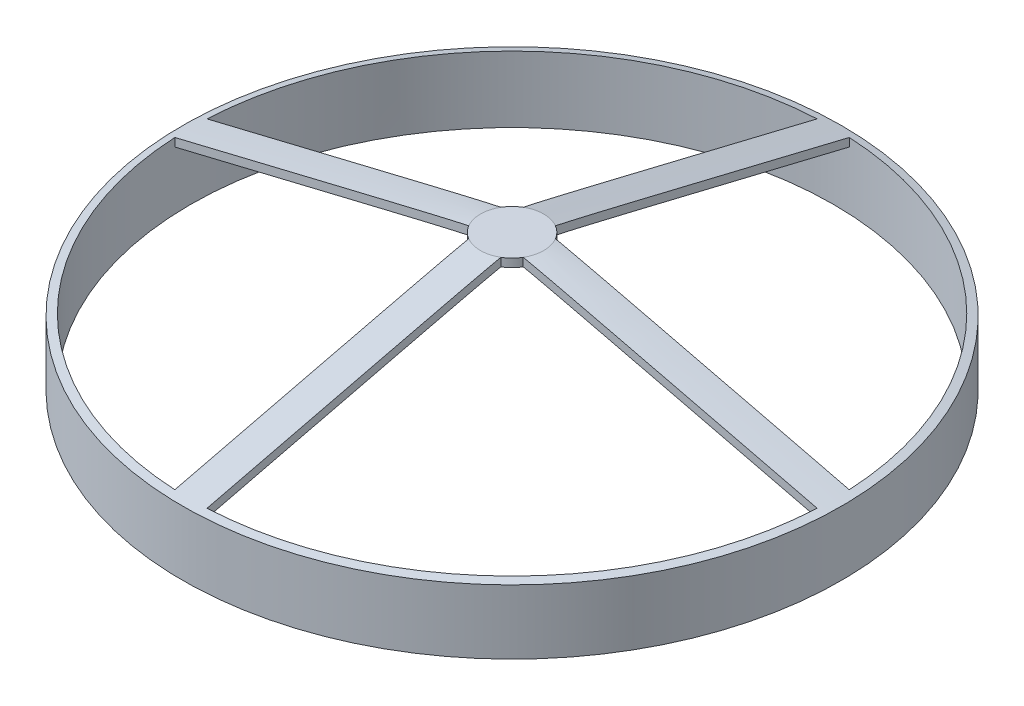
from build123d import *
from build123d.topology import SkipClean

# Parameters (mm, degrees)
SHELL1_T           = -3.175
CUT_EXTRUDE1_DEPTH = 192.844629518


with BuildPart() as part:
    # Sketch1 → Revolve1 (revolve)
    with BuildSketch(Plane.XY):
        Polygon((0, 0), (0, 53.975), (12.5, 53.975), (130.175, 25.4), (130.175, 0), align=None)
    revolve(axis=Axis((0, 0, 0), (0, 1, 0)))

    # Shell1
    shell1_openings = [part.faces().sort_by_distance(p)[0] for p in [
        (0, 0, 0),
    ]]
    offset(amount=SHELL1_T, openings=shell1_openings, kind=Kind.INTERSECTION)

    # Sketch2 → Cut-Extrude1 (cut, through all)
    with SkipClean():  # the faces are left unmerged after this step: merging them gives an invalid solid
        with BuildSketch(Plane(origin=(0, 53.975, 0), x_dir=(1, 0, 0), z_dir=(0, 1, 0))):
            with BuildLine():
                ThreePointArc((-10.76696336, 6.35), (-8.838834765, 8.838834765), (-6.35, 10.76696336))
                Line((-6.35, 10.76696336), (-6.35, 126.841150657))
                ThreePointArc((-6.35, 126.841150657), (-89.802561211, 89.802561211), (-126.841150657, 6.35))
                Line((-126.841150657, 6.35), (-10.76696336, 6.35))
            make_face()
            with BuildLine():
                Line((6.35, 126.841150657), (6.35, 10.76696336))
                ThreePointArc((6.35, 10.76696336), (8.838834765, 8.838834765), (10.76696336, 6.35))
                Line((10.76696336, 6.35), (126.841150657, 6.35))
                ThreePointArc((126.841150657, 6.35), (89.802561211, 89.802561211), (6.35, 126.841150657))
            make_face()
            with BuildLine():
                ThreePointArc((-6.35, -10.76696336), (-8.838834765, -8.838834765), (-10.76696336, -6.35))
                Line((-10.76696336, -6.35), (-126.841150657, -6.35))
                ThreePointArc((-126.841150657, -6.35), (-89.802561211, -89.802561211), (-6.35, -126.841150657))
                Line((-6.35, -126.841150657), (-6.35, -10.76696336))
            make_face()
            with BuildLine():
                Line((126.841150657, -6.35), (10.76696336, -6.35))
                ThreePointArc((10.76696336, -6.35), (8.838834765, -8.838834765), (6.35, -10.76696336))
                Line((6.35, -10.76696336), (6.35, -126.841150657))
                ThreePointArc((6.35, -126.841150657), (89.802561211, -89.802561211), (126.841150657, -6.35))
            make_face()
        extrude(amount=-CUT_EXTRUDE1_DEPTH, mode=Mode.SUBTRACT)


solid = part.part
